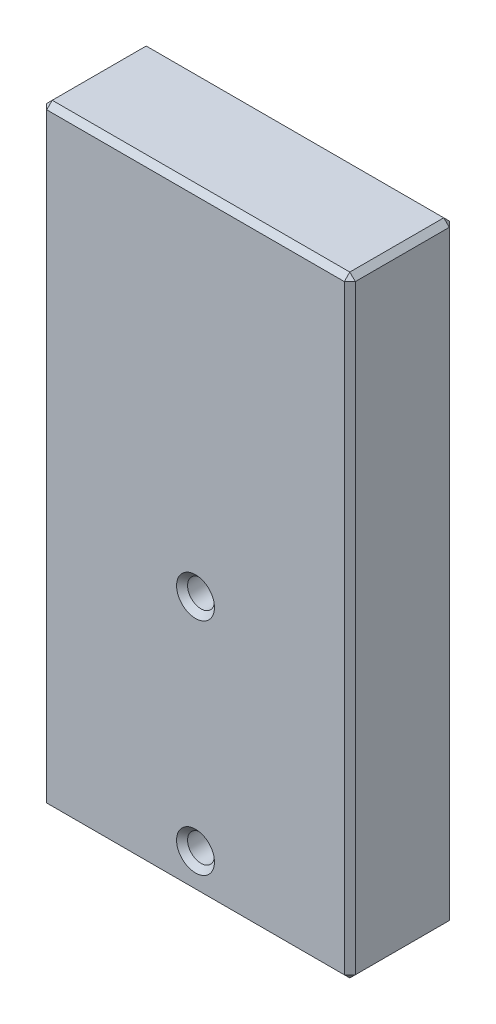
from build123d import *

# Parameters (mm, degrees)
SKETCH1_W           = 28
SKETCH1_H           = 55.475
BOSS_EXTRUDE1_DEPTH = 9.525
SKETCH2_R           = 1.2195
CUT_EXTRUDE1_DEPTH  = 20
SKETCH3_R           = 1.2195
CUT_EXTRUDE2_DEPTH  = 63.866535215
CHAMFER1_SIZE       = 0.5
CHAMFER2_SIZE       = 0.5


with BuildPart() as part:
    # Sketch1 → Boss-Extrude1 (new body)
    with BuildSketch(Plane.XY):
        with Locations((14, 27.7375)):
            Rectangle(SKETCH1_W, SKETCH1_H)
    extrude(amount=BOSS_EXTRUDE1_DEPTH)

    # Sketch2 → Cut-Extrude1 (cut)
    with BuildSketch(Plane.XZ):
        with Locations((5, 4.7625)):
            Circle(SKETCH2_R)
        with Locations((23, 4.7625)):
            Circle(SKETCH2_R)
    extrude(amount=-CUT_EXTRUDE1_DEPTH, mode=Mode.SUBTRACT)

    # Sketch3 → Cut-Extrude2 (cut, through all)
    with BuildSketch(Plane.XY.offset(9.525)):
        with Locations((14, 3.475)):
            Circle(SKETCH3_R)
        with Locations((14, 23.475)):
            Circle(SKETCH3_R)
    extrude(amount=-CUT_EXTRUDE2_DEPTH, mode=Mode.SUBTRACT)

    # Chamfer1
    chamfer1_edges = [part.edges().sort_by_distance(p)[0] for p in [
        (14, 0, 0),
        (28, 0, 4.7625),
        (28, 27.7375, 0),
        (14, 55.475, 0),
        (28, 55.475, 4.7625),
        (28, 27.7375, 9.525),
        (14, 55.475, 9.525),
        (14, 0, 9.525),
        (0, 0, 4.7625),
        (0, 27.7375, 0),
        (0, 55.475, 4.7625),
        (0, 27.7375, 9.525),
    ]]
    chamfer(chamfer1_edges, length=CHAMFER1_SIZE)

    # Chamfer2
    chamfer2_edges = [part.edges().sort_by_distance(p)[0] for p in [
        (21.7805, 0, 4.7625),
        (3.7805, 0, 4.7625),
        (12.7805, 3.475, 0),
        (12.7805, 23.475, 0),
        (12.7805, 3.475, 9.525),
        (12.7805, 23.475, 9.525),
    ]]
    chamfer(chamfer2_edges, length=CHAMFER2_SIZE)


solid = part.part
